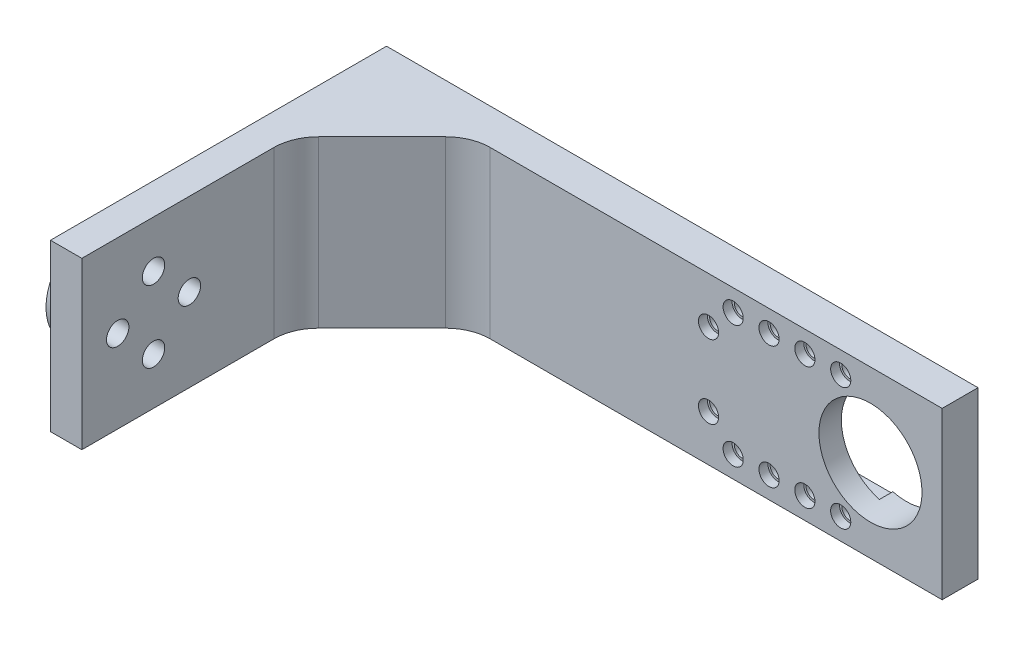
from build123d import *

# Parameters (mm, degrees)
BOSS_EXTRUDE1_DEPTH = 37
CUT_EXTRUDE1_REACH  = 158.263
CUT_EXTRUDE2_REACH  = 158.263
SKETCH3_R           = 1.75
CUT_EXTRUDE5_REACH  = 158.263
SKETCH5_R           = 1.75
BOSS_EXTRUDE3_START = 6
SKETCH6_R           = 11
SKETCH6_R_2         = 1.75
BOSS_EXTRUDE3_DEPTH = 6
SKETCH4_W           = 38
SKETCH4_H           = 23
CUT_EXTRUDE6_DEPTH  = 3
SKETCH7_W           = 3
SKETCH7_H           = 23
BOSS_EXTRUDE4_DEPTH = 7.5
CUT_EXTRUDE7_REACH  = 154.584
SKETCH8_R           = 1.75
SKETCH9_R           = 2.25
CUT_EXTRUDE8_DEPTH  = 2
SKETCH10_R          = 2.5
CUT_EXTRUDE9_DEPTH  = 5
CHAMFER1_SIZE       = 20
FILLET5_R           = 10


with BuildPart() as part:
    # Sketch1 → Boss-Extrude1 (new body)
    with BuildSketch(Plane(origin=(0, 0, 0), x_dir=(1, 0, 0), z_dir=(0, 1, 0))):
        Polygon((0, 0), (0, 75), (132, 75), (132, 67), (7, 67), (7, 0), align=None)
    extrude(amount=BOSS_EXTRUDE1_DEPTH)

    # Sketch2 → Cut-Extrude1 (cut, up to next)
    with BuildSketch(Plane(origin=(0, 0, -75), x_dir=(-1, 0, 0), z_dir=(0, 0, -1)), mode=Mode.PRIVATE) as cut_extrude1_sk1:
        with BuildLine():
            ThreePointArc((-127.5, 18.5), (-116, 7), (-104.5, 18.5))
            ThreePointArc((-104.5, 18.5), (-116, 30), (-127.5, 18.5))
        make_face()
    cut_extrude1_tool1 = extrude(cut_extrude1_sk1.sketch, amount=-CUT_EXTRUDE1_REACH, mode=Mode.PRIVATE) & part.part
    add(cut_extrude1_tool1.solids().sort_by_distance((116, 18.5, -75))[0], mode=Mode.SUBTRACT)

    # Sketch3 → Cut-Extrude2 (cut, up to next)
    with BuildSketch(Plane(origin=(0, 0, -75), x_dir=(-1, 0, 0), z_dir=(0, 0, -1)), mode=Mode.PRIVATE) as cut_extrude2_sk1:
        with Locations((-109.36, 32.19)):
            Circle(SKETCH3_R)
    cut_extrude2_tool1 = extrude(cut_extrude2_sk1.sketch, amount=-CUT_EXTRUDE2_REACH, mode=Mode.PRIVATE) & part.part
    # Sketch3 → Cut-Extrude2 (cut, up to next)
    with BuildSketch(Plane(origin=(0, 0, -75), x_dir=(-1, 0, 0), z_dir=(0, 0, -1)), mode=Mode.PRIVATE) as cut_extrude2_sk2:
        with Locations((-101.36, 32.19)):
            Circle(SKETCH3_R)
    cut_extrude2_tool2 = extrude(cut_extrude2_sk2.sketch, amount=-CUT_EXTRUDE2_REACH, mode=Mode.PRIVATE) & part.part
    # Sketch3 → Cut-Extrude2 (cut, up to next)
    with BuildSketch(Plane(origin=(0, 0, -75), x_dir=(-1, 0, 0), z_dir=(0, 0, -1)), mode=Mode.PRIVATE) as cut_extrude2_sk3:
        with Locations((-93.36, 32.19)):
            Circle(SKETCH3_R)
    cut_extrude2_tool3 = extrude(cut_extrude2_sk3.sketch, amount=-CUT_EXTRUDE2_REACH, mode=Mode.PRIVATE) & part.part
    # Sketch3 → Cut-Extrude2 (cut, up to next)
    with BuildSketch(Plane(origin=(0, 0, -75), x_dir=(-1, 0, 0), z_dir=(0, 0, -1)), mode=Mode.PRIVATE) as cut_extrude2_sk4:
        with Locations((-85.36, 32.19)):
            Circle(SKETCH3_R)
    cut_extrude2_tool4 = extrude(cut_extrude2_sk4.sketch, amount=-CUT_EXTRUDE2_REACH, mode=Mode.PRIVATE) & part.part
    # Sketch3 → Cut-Extrude2 (cut, up to next)
    with BuildSketch(Plane(origin=(0, 0, -75), x_dir=(-1, 0, 0), z_dir=(0, 0, -1)), mode=Mode.PRIVATE) as cut_extrude2_sk5:
        with Locations((-85.36, 4.81)):
            Circle(SKETCH3_R)
    cut_extrude2_tool5 = extrude(cut_extrude2_sk5.sketch, amount=-CUT_EXTRUDE2_REACH, mode=Mode.PRIVATE) & part.part
    # Sketch3 → Cut-Extrude2 (cut, up to next)
    with BuildSketch(Plane(origin=(0, 0, -75), x_dir=(-1, 0, 0), z_dir=(0, 0, -1)), mode=Mode.PRIVATE) as cut_extrude2_sk6:
        with Locations((-93.36, 4.81)):
            Circle(SKETCH3_R)
    cut_extrude2_tool6 = extrude(cut_extrude2_sk6.sketch, amount=-CUT_EXTRUDE2_REACH, mode=Mode.PRIVATE) & part.part
    # Sketch3 → Cut-Extrude2 (cut, up to next)
    with BuildSketch(Plane(origin=(0, 0, -75), x_dir=(-1, 0, 0), z_dir=(0, 0, -1)), mode=Mode.PRIVATE) as cut_extrude2_sk7:
        with Locations((-101.36, 4.81)):
            Circle(SKETCH3_R)
    cut_extrude2_tool7 = extrude(cut_extrude2_sk7.sketch, amount=-CUT_EXTRUDE2_REACH, mode=Mode.PRIVATE) & part.part
    # Sketch3 → Cut-Extrude2 (cut, up to next)
    with BuildSketch(Plane(origin=(0, 0, -75), x_dir=(-1, 0, 0), z_dir=(0, 0, -1)), mode=Mode.PRIVATE) as cut_extrude2_sk8:
        with Locations((-109.36, 4.81)):
            Circle(SKETCH3_R)
    cut_extrude2_tool8 = extrude(cut_extrude2_sk8.sketch, amount=-CUT_EXTRUDE2_REACH, mode=Mode.PRIVATE) & part.part
    # Sketch3 → Cut-Extrude2 (cut, up to next)
    with BuildSketch(Plane(origin=(0, 0, -75), x_dir=(-1, 0, 0), z_dir=(0, 0, -1)), mode=Mode.PRIVATE) as cut_extrude2_sk9:
        with Locations((-79.86, 26.69)):
            Circle(SKETCH3_R)
    cut_extrude2_tool9 = extrude(cut_extrude2_sk9.sketch, amount=-CUT_EXTRUDE2_REACH, mode=Mode.PRIVATE) & part.part
    # Sketch3 → Cut-Extrude2 (cut, up to next)
    with BuildSketch(Plane(origin=(0, 0, -75), x_dir=(-1, 0, 0), z_dir=(0, 0, -1)), mode=Mode.PRIVATE) as cut_extrude2_sk10:
        with Locations((-79.86, 10.31)):
            Circle(SKETCH3_R)
    cut_extrude2_tool10 = extrude(cut_extrude2_sk10.sketch, amount=-CUT_EXTRUDE2_REACH, mode=Mode.PRIVATE) & part.part
    add(cut_extrude2_tool1.solids().sort_by_distance((109.36, 32.19, -75))[0], mode=Mode.SUBTRACT)
    add(cut_extrude2_tool2.solids().sort_by_distance((101.36, 32.19, -75))[0], mode=Mode.SUBTRACT)
    add(cut_extrude2_tool3.solids().sort_by_distance((93.36, 32.19, -75))[0], mode=Mode.SUBTRACT)
    add(cut_extrude2_tool4.solids().sort_by_distance((85.36, 32.19, -75))[0], mode=Mode.SUBTRACT)
    add(cut_extrude2_tool5.solids().sort_by_distance((85.36, 4.81, -75))[0], mode=Mode.SUBTRACT)
    add(cut_extrude2_tool6.solids().sort_by_distance((93.36, 4.81, -75))[0], mode=Mode.SUBTRACT)
    add(cut_extrude2_tool7.solids().sort_by_distance((101.36, 4.81, -75))[0], mode=Mode.SUBTRACT)
    add(cut_extrude2_tool8.solids().sort_by_distance((109.36, 4.81, -75))[0], mode=Mode.SUBTRACT)
    add(cut_extrude2_tool9.solids().sort_by_distance((79.86, 26.69, -75))[0], mode=Mode.SUBTRACT)
    add(cut_extrude2_tool10.solids().sort_by_distance((79.86, 10.31, -75))[0], mode=Mode.SUBTRACT)

    # Sketch5 → Cut-Extrude5 (cut, up to next)
    with BuildSketch(Plane.ZY, mode=Mode.PRIVATE) as cut_extrude5_sk1:
        with Locations((-16, 10.5)):
            Circle(SKETCH5_R)
    cut_extrude5_tool1 = extrude(cut_extrude5_sk1.sketch, amount=-CUT_EXTRUDE5_REACH, mode=Mode.PRIVATE) & part.part
    # Sketch5 → Cut-Extrude5 (cut, up to next)
    with BuildSketch(Plane.ZY, mode=Mode.PRIVATE) as cut_extrude5_sk2:
        with Locations((-24, 18.5)):
            Circle(SKETCH5_R)
    cut_extrude5_tool2 = extrude(cut_extrude5_sk2.sketch, amount=-CUT_EXTRUDE5_REACH, mode=Mode.PRIVATE) & part.part
    # Sketch5 → Cut-Extrude5 (cut, up to next)
    with BuildSketch(Plane.ZY, mode=Mode.PRIVATE) as cut_extrude5_sk3:
        with Locations((-16, 26.5)):
            Circle(SKETCH5_R)
    cut_extrude5_tool3 = extrude(cut_extrude5_sk3.sketch, amount=-CUT_EXTRUDE5_REACH, mode=Mode.PRIVATE) & part.part
    # Sketch5 → Cut-Extrude5 (cut, up to next)
    with BuildSketch(Plane.ZY, mode=Mode.PRIVATE) as cut_extrude5_sk4:
        with Locations((-8, 18.5)):
            Circle(SKETCH5_R)
    cut_extrude5_tool4 = extrude(cut_extrude5_sk4.sketch, amount=-CUT_EXTRUDE5_REACH, mode=Mode.PRIVATE) & part.part
    add(cut_extrude5_tool1.solids().sort_by_distance((0, 10.5, -16))[0], mode=Mode.SUBTRACT)
    add(cut_extrude5_tool2.solids().sort_by_distance((0, 18.5, -24))[0], mode=Mode.SUBTRACT)
    add(cut_extrude5_tool3.solids().sort_by_distance((0, 26.5, -16))[0], mode=Mode.SUBTRACT)
    add(cut_extrude5_tool4.solids().sort_by_distance((0, 18.5, -8))[0], mode=Mode.SUBTRACT)

    # Sketch6 → Boss-Extrude3 (add)
    with BuildSketch(Plane.ZY.offset(BOSS_EXTRUDE3_START)):
        with Locations((-16, 18.5)):
            Circle(SKETCH6_R)
        with Locations((-16, 10.5)):
            Circle(SKETCH6_R_2, mode=Mode.SUBTRACT)
        with BuildLine():
            ThreePointArc((-9.75, 18.5), (-8, 20.25), (-6.25, 18.5))
            ThreePointArc((-6.25, 18.5), (-8, 16.75), (-9.75, 18.5))
        make_face(mode=Mode.SUBTRACT)
        with Locations((-24, 18.5)):
            Circle(SKETCH6_R_2, mode=Mode.SUBTRACT)
        with Locations((-16, 26.5)):
            Circle(SKETCH6_R_2, mode=Mode.SUBTRACT)
    extrude(amount=-BOSS_EXTRUDE3_DEPTH)

    # Sketch4 → Cut-Extrude6 (cut)
    with BuildSketch(Plane(origin=(0, 0, -75), x_dir=(-1, 0, 0), z_dir=(0, 0, -1))):
        with Locations((-94, 18.5)):
            Rectangle(SKETCH4_W, SKETCH4_H)
    extrude(amount=-CUT_EXTRUDE6_DEPTH, mode=Mode.SUBTRACT)

    # Sketch7 → Boss-Extrude4 (add)
    with BuildSketch(Plane(origin=(75, 0, 0), x_dir=(0, 0, -1), z_dir=(1, 0, 0))):
        with Locations((73.5, 18.5)):
            Rectangle(SKETCH7_W, SKETCH7_H)
    extrude(amount=BOSS_EXTRUDE4_DEPTH)

    # Sketch8 → Cut-Extrude7 (cut, up to next)
    with BuildSketch(Plane.XY.offset(-67), mode=Mode.PRIVATE) as cut_extrude7_sk1:
        with Locations((79.86, 10.31)):
            Circle(SKETCH8_R)
    cut_extrude7_tool1 = extrude(cut_extrude7_sk1.sketch, amount=-CUT_EXTRUDE7_REACH, mode=Mode.PRIVATE) & part.part
    # Sketch8 → Cut-Extrude7 (cut, up to next)
    with BuildSketch(Plane.XY.offset(-67), mode=Mode.PRIVATE) as cut_extrude7_sk2:
        with Locations((79.86, 26.69)):
            Circle(SKETCH8_R)
    cut_extrude7_tool2 = extrude(cut_extrude7_sk2.sketch, amount=-CUT_EXTRUDE7_REACH, mode=Mode.PRIVATE) & part.part
    add(cut_extrude7_tool1.solids().sort_by_distance((79.86, 10.31, -67))[0], mode=Mode.SUBTRACT)
    add(cut_extrude7_tool2.solids().sort_by_distance((79.86, 26.69, -67))[0], mode=Mode.SUBTRACT)

    # Sketch9 → Cut-Extrude8 (cut)
    with BuildSketch(Plane.XY.offset(-67)):
        with Locations((79.86, 26.69)):
            Circle(SKETCH9_R)
        with Locations((85.36, 32.19)):
            Circle(SKETCH9_R)
        with Locations((93.36, 32.19)):
            Circle(SKETCH9_R)
        with Locations((101.36, 32.19)):
            Circle(SKETCH9_R)
        with Locations((109.36, 32.19)):
            Circle(SKETCH9_R)
        with Locations((79.86, 10.31)):
            Circle(SKETCH9_R)
        with Locations((85.36, 4.81)):
            Circle(SKETCH9_R)
        with Locations((93.36, 4.81)):
            Circle(SKETCH9_R)
        with Locations((101.36, 4.81)):
            Circle(SKETCH9_R)
        with Locations((109.36, 4.81)):
            Circle(SKETCH9_R)
    extrude(amount=-CUT_EXTRUDE8_DEPTH, mode=Mode.SUBTRACT)

    # Sketch10 → Cut-Extrude9 (cut)
    with BuildSketch(Plane(origin=(7, 0, 0), x_dir=(0, 0, -1), z_dir=(1, 0, 0))):
        with Locations((24, 18.5)):
            Circle(SKETCH10_R)
        with Locations((16, 10.5)):
            Circle(SKETCH10_R)
        with Locations((8, 18.5)):
            Circle(SKETCH10_R)
        with Locations((16, 26.5)):
            Circle(SKETCH10_R)
    extrude(amount=-CUT_EXTRUDE9_DEPTH, mode=Mode.SUBTRACT)

    # Chamfer1
    chamfer1_edges = [part.edges().sort_by_distance(p)[0] for p in [
        (7, 18.5, -67),
    ]]
    chamfer(chamfer1_edges, length=CHAMFER1_SIZE)

    # Fillet5
    fillet5_edges = [part.edges().sort_by_distance(p)[0] for p in [
        (7, 18.5, -47),
        (27, 18.5, -67),
    ]]
    fillet(fillet5_edges, radius=FILLET5_R)


solid = part.part
